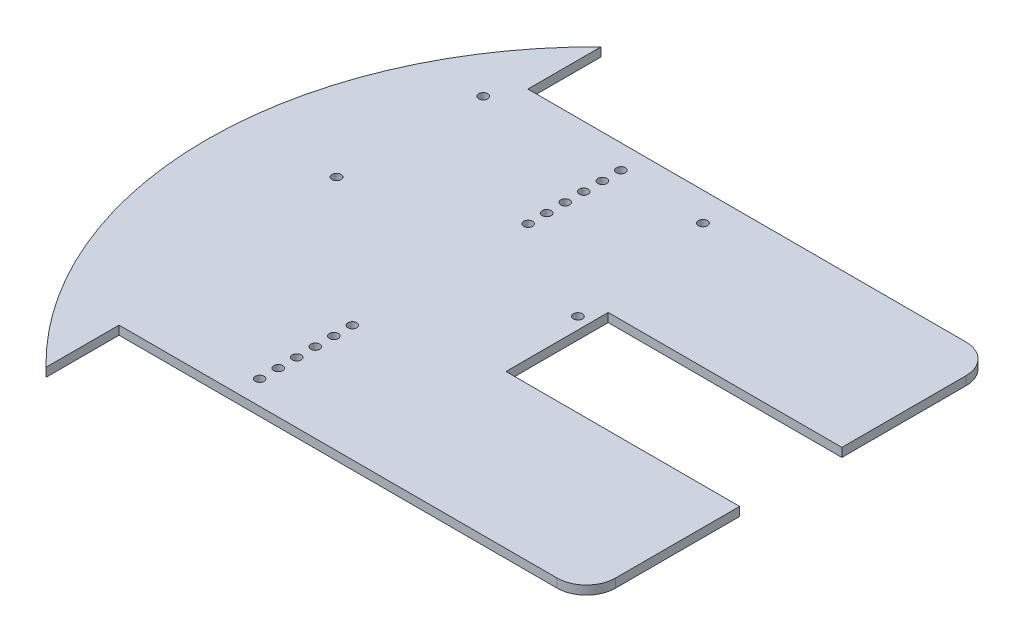
from build123d import *

# Parameters (mm, degrees)
SKETCH1_R           = 1.525
BOSS_EXTRUDE1_DEPTH = 3
SKETCH2_W           = 80
SKETCH2_H           = 35
CUT_EXTRUDE1_DEPTH  = 5
SKETCH4_R           = 1.55
CUT_EXTRUDE2_DEPTH  = 277.097497981


with BuildPart() as part:
    # Sketch1 → Boss-Extrude1 (new body)
    with BuildSketch(Plane(origin=(0, 3, 0), x_dir=(1, 0, 0), z_dir=(0, 1, 0))):
        with BuildLine():
            Line((200.301843205, 35), (200.301843205, 155))
            ThreePointArc((200.301843205, 155), (197.372911017, 162.071067812), (190.301843205, 165))
            Line((190.301843205, 165), (40.301843205, 165))
            Line((40.301843205, 165), (40.301843205, 190))
            ThreePointArc((40.301843205, 190), (0.301843205, 95), (40.301843205, 0))
            Line((40.301843205, 0), (40.301843205, 25))
            Line((40.301843205, 25), (190.301843205, 25))
            ThreePointArc((190.301843205, 25), (197.372911017, 27.928932188), (200.301843205, 35))
        make_face()
        with Locations((80.301843205, 33.16)):
            Circle(SKETCH1_R, mode=Mode.SUBTRACT)
        with Locations((80.301843205, 125.09)):
            Circle(SKETCH1_R, mode=Mode.SUBTRACT)
        with Locations((80.301843205, 131.44)):
            Circle(SKETCH1_R, mode=Mode.SUBTRACT)
        with Locations((80.301843205, 137.79)):
            Circle(SKETCH1_R, mode=Mode.SUBTRACT)
        with Locations((80.301843205, 64.91)):
            Circle(SKETCH1_R, mode=Mode.SUBTRACT)
        with Locations((80.301843205, 156.84)):
            Circle(SKETCH1_R, mode=Mode.SUBTRACT)
        with Locations((80.301843205, 150.49)):
            Circle(SKETCH1_R, mode=Mode.SUBTRACT)
        with Locations((80.301843205, 144.14)):
            Circle(SKETCH1_R, mode=Mode.SUBTRACT)
        with Locations((80.301843205, 58.56)):
            Circle(SKETCH1_R, mode=Mode.SUBTRACT)
        with Locations((80.301843205, 52.21)):
            Circle(SKETCH1_R, mode=Mode.SUBTRACT)
        with Locations((80.301843205, 45.86)):
            Circle(SKETCH1_R, mode=Mode.SUBTRACT)
        with Locations((80.301843205, 39.51)):
            Circle(SKETCH1_R, mode=Mode.SUBTRACT)
    extrude(amount=-BOSS_EXTRUDE1_DEPTH)

    # Sketch2 → Cut-Extrude1 (cut)
    with BuildSketch(Plane(origin=(0, 3, 0), x_dir=(1, 0, 0), z_dir=(0, 1, 0))):
        with Locations((160.301843205, 95)):
            Rectangle(SKETCH2_W, SKETCH2_H)
    extrude(amount=-CUT_EXTRUDE1_DEPTH, mode=Mode.SUBTRACT)

    # Sketch4 → Cut-Extrude2 (cut, through all)
    with BuildSketch(Plane(origin=(0, 3, 0), x_dir=(1, 0, 0), z_dir=(0, 1, 0))):
        with Locations((34.819271837, 155.2)):
            Circle(SKETCH4_R)
        with Locations((33.619271837, 106.15)):
            Circle(SKETCH4_R)
        with Locations((110.019271837, 155.2)):
            Circle(SKETCH4_R)
        with Locations((116.269271837, 106.15)):
            Circle(SKETCH4_R)
    extrude(amount=-CUT_EXTRUDE2_DEPTH, mode=Mode.SUBTRACT)


solid = part.part
